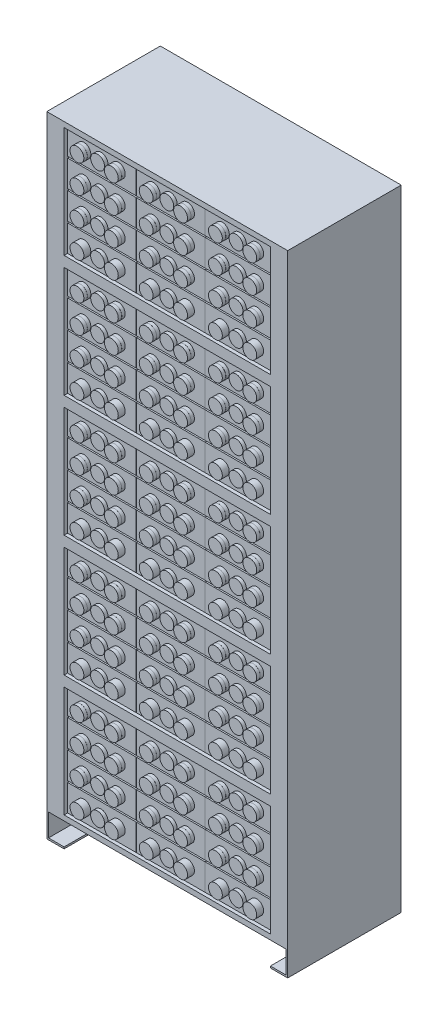
from build123d import *

# Parameters (mm, degrees)
SKETCH1_W           = 596
SKETCH1_H           = 320
BOSS_EXTRUDE1_DEPTH = 405
SKETCH2_W           = 198.4
SKETCH2_H           = 76.8
BOSS_EXTRUDE2_DEPTH = 318
SKETCH3_R           = 20
BOSS_EXTRUDE3_DEPTH = 10
CUT_EXTRUDE1_DEPTH  = 77
SKETCH5_R           = 20
BOSS_EXTRUDE5_DEPTH = 10


with BuildPart() as part:
    # Sketch1 → Boss-Extrude1 (new body)
    with BuildSketch(Plane.XY):
        Polygon((0, 0), (0, 1820), (696, 1820), (696, 0), (646, 0), (646, 5), (691, 5), (691, 70), (646, 70), (50, 70), (5, 70), (5, 5), (50, 5), (50, 0), align=None)
        with Locations((348, 595)):
            Rectangle(SKETCH1_W, SKETCH1_H, mode=Mode.SUBTRACT)
        with Locations((348, 245)):
            Rectangle(SKETCH1_W, SKETCH1_H, mode=Mode.SUBTRACT)
        with Locations((348, 945)):
            Rectangle(SKETCH1_W, SKETCH1_H, mode=Mode.SUBTRACT)
        with Locations((348, 1295)):
            Rectangle(SKETCH1_W, SKETCH1_H, mode=Mode.SUBTRACT)
        with Locations((348, 1645)):
            Rectangle(SKETCH1_W, SKETCH1_H, mode=Mode.SUBTRACT)
    extrude(amount=-BOSS_EXTRUDE1_DEPTH)

    # Sketch2 → Boss-Extrude2 (add)
    with BuildSketch(Plane(origin=(0, 0, -405), x_dir=(-1, 0, 0), z_dir=(0, 0, -1))):
        with Locations((-348, 122.966053356)):
            Rectangle(SKETCH2_W, SKETCH2_H)
        with Locations((-348, 472.966053356)):
            Rectangle(SKETCH2_W, SKETCH2_H)
        with Locations((-149.2, 472.966053356)):
            Rectangle(SKETCH2_W, SKETCH2_H)
        with Locations((-149.2, 122.966053356)):
            Rectangle(SKETCH2_W, SKETCH2_H)
        with Locations((-546.8, 122.966053356)):
            Rectangle(SKETCH2_W, SKETCH2_H)
        with Locations((-348, 204.177368904)):
            Rectangle(SKETCH2_W, SKETCH2_H)
        with Locations((-546.8, 204.177368904)):
            Rectangle(SKETCH2_W, SKETCH2_H)
        with Locations((-348, 285.388684452)):
            Rectangle(SKETCH2_W, SKETCH2_H)
        with Locations((-546.8, 285.388684452)):
            Rectangle(SKETCH2_W, SKETCH2_H)
        with Locations((-348, 366.6)):
            Rectangle(SKETCH2_W, SKETCH2_H)
        with Locations((-546.8, 366.6)):
            Rectangle(SKETCH2_W, SKETCH2_H)
        with Locations((-149.2, 204.177368904)):
            Rectangle(SKETCH2_W, SKETCH2_H)
        with Locations((-149.2, 285.388684452)):
            Rectangle(SKETCH2_W, SKETCH2_H)
        with Locations((-149.2, 366.6)):
            Rectangle(SKETCH2_W, SKETCH2_H)
        with Locations((-546.8, 472.966053356)):
            Rectangle(SKETCH2_W, SKETCH2_H)
        with Locations((-348, 554.177368904)):
            Rectangle(SKETCH2_W, SKETCH2_H)
        with Locations((-546.8, 554.177368904)):
            Rectangle(SKETCH2_W, SKETCH2_H)
        with Locations((-348, 635.388684452)):
            Rectangle(SKETCH2_W, SKETCH2_H)
        with Locations((-546.8, 635.388684452)):
            Rectangle(SKETCH2_W, SKETCH2_H)
        with Locations((-348, 716.6)):
            Rectangle(SKETCH2_W, SKETCH2_H)
        with Locations((-546.8, 716.6)):
            Rectangle(SKETCH2_W, SKETCH2_H)
        with Locations((-149.2, 554.177368904)):
            Rectangle(SKETCH2_W, SKETCH2_H)
        with Locations((-149.2, 635.388684452)):
            Rectangle(SKETCH2_W, SKETCH2_H)
        with Locations((-149.2, 716.6)):
            Rectangle(SKETCH2_W, SKETCH2_H)
        with Locations((-348, 822.966053356)):
            Rectangle(SKETCH2_W, SKETCH2_H)
        with Locations((-149.2, 822.966053356)):
            Rectangle(SKETCH2_W, SKETCH2_H)
        with Locations((-546.8, 822.966053356)):
            Rectangle(SKETCH2_W, SKETCH2_H)
        with Locations((-348, 904.177368904)):
            Rectangle(SKETCH2_W, SKETCH2_H)
        with Locations((-546.8, 904.177368904)):
            Rectangle(SKETCH2_W, SKETCH2_H)
        with Locations((-348, 985.388684452)):
            Rectangle(SKETCH2_W, SKETCH2_H)
        with Locations((-546.8, 985.388684452)):
            Rectangle(SKETCH2_W, SKETCH2_H)
        with Locations((-348, 1066.6)):
            Rectangle(SKETCH2_W, SKETCH2_H)
        with Locations((-546.8, 1066.6)):
            Rectangle(SKETCH2_W, SKETCH2_H)
        with Locations((-149.2, 904.177368904)):
            Rectangle(SKETCH2_W, SKETCH2_H)
        with Locations((-149.2, 985.388684452)):
            Rectangle(SKETCH2_W, SKETCH2_H)
        with Locations((-149.2, 1066.6)):
            Rectangle(SKETCH2_W, SKETCH2_H)
        with Locations((-348, 1172.966053356)):
            Rectangle(SKETCH2_W, SKETCH2_H)
        with Locations((-149.2, 1172.966053356)):
            Rectangle(SKETCH2_W, SKETCH2_H)
        with Locations((-546.8, 1172.966053356)):
            Rectangle(SKETCH2_W, SKETCH2_H)
        with Locations((-348, 1254.177368904)):
            Rectangle(SKETCH2_W, SKETCH2_H)
        with Locations((-546.8, 1254.177368904)):
            Rectangle(SKETCH2_W, SKETCH2_H)
        with Locations((-348, 1335.388684452)):
            Rectangle(SKETCH2_W, SKETCH2_H)
        with Locations((-546.8, 1335.388684452)):
            Rectangle(SKETCH2_W, SKETCH2_H)
        with Locations((-348, 1416.6)):
            Rectangle(SKETCH2_W, SKETCH2_H)
        with Locations((-546.8, 1416.6)):
            Rectangle(SKETCH2_W, SKETCH2_H)
        with Locations((-149.2, 1254.177368904)):
            Rectangle(SKETCH2_W, SKETCH2_H)
        with Locations((-149.2, 1335.388684452)):
            Rectangle(SKETCH2_W, SKETCH2_H)
        with Locations((-149.2, 1416.6)):
            Rectangle(SKETCH2_W, SKETCH2_H)
        with Locations((-348, 1522.966053356)):
            Rectangle(SKETCH2_W, SKETCH2_H)
        with Locations((-149.2, 1522.966053356)):
            Rectangle(SKETCH2_W, SKETCH2_H)
        with Locations((-546.8, 1522.966053356)):
            Rectangle(SKETCH2_W, SKETCH2_H)
        with Locations((-348, 1604.177368904)):
            Rectangle(SKETCH2_W, SKETCH2_H)
        with Locations((-546.8, 1604.177368904)):
            Rectangle(SKETCH2_W, SKETCH2_H)
        with Locations((-348, 1685.388684452)):
            Rectangle(SKETCH2_W, SKETCH2_H)
        with Locations((-546.8, 1685.388684452)):
            Rectangle(SKETCH2_W, SKETCH2_H)
        with Locations((-348, 1766.6)):
            Rectangle(SKETCH2_W, SKETCH2_H)
        with Locations((-546.8, 1766.6)):
            Rectangle(SKETCH2_W, SKETCH2_H)
        with Locations((-149.2, 1604.177368904)):
            Rectangle(SKETCH2_W, SKETCH2_H)
        with Locations((-149.2, 1685.388684452)):
            Rectangle(SKETCH2_W, SKETCH2_H)
        with Locations((-149.2, 1766.6)):
            Rectangle(SKETCH2_W, SKETCH2_H)
    extrude(amount=-BOSS_EXTRUDE2_DEPTH)


with BuildPart() as boss_extrude2_piece_1:
    # of the separate pieces the step leaves, piece 1, a body of its own (boss_extrude2_pieces)
    add(part.part.solids().sort_by_distance((0, 0, 0))[0])



with BuildPart() as boss_extrude2_piece_2:
    # of the separate pieces the step leaves, piece 2, a body of its own (boss_extrude2_pieces)
    add(part.part.solids().sort_by_distance((447.2, 1723.788684452, -405))[0])


with BuildPart() as boss_extrude2_piece_3:
    # of the separate pieces the step leaves, piece 3, a body of its own (boss_extrude2_pieces)
    add(part.part.solids().sort_by_distance((447.2, 592.577368904, -405))[0])


with BuildPart() as boss_extrude2_piece_4:
    # of the separate pieces the step leaves, piece 4, a body of its own (boss_extrude2_pieces)
    add(part.part.solids().sort_by_distance((447.2, 942.577368904, -405))[0])


with BuildPart() as boss_extrude2_piece_5:
    # of the separate pieces the step leaves, piece 5, a body of its own (boss_extrude2_pieces)
    add(part.part.solids().sort_by_distance((447.2, 242.577368904, -405))[0])


with BuildPart() as boss_extrude2_piece_6:
    # of the separate pieces the step leaves, piece 6, a body of its own (boss_extrude2_pieces)
    add(part.part.solids().sort_by_distance((447.2, 1642.577368904, -405))[0])


with BuildPart() as boss_extrude2_piece_7:
    # of the separate pieces the step leaves, piece 7, a body of its own (boss_extrude2_pieces)
    add(part.part.solids().sort_by_distance((447.2, 323.788684452, -405))[0])


with BuildPart() as boss_extrude2_piece_8:
    # of the separate pieces the step leaves, piece 8, a body of its own (boss_extrude2_pieces)
    add(part.part.solids().sort_by_distance((447.2, 673.788684452, -405))[0])


with BuildPart() as boss_extrude2_piece_9:
    # of the separate pieces the step leaves, piece 9, a body of its own (boss_extrude2_pieces)
    add(part.part.solids().sort_by_distance((447.2, 1023.788684452, -405))[0])


with BuildPart() as boss_extrude2_piece_10:
    # of the separate pieces the step leaves, piece 10, a body of its own (boss_extrude2_pieces)
    add(part.part.solids().sort_by_distance((447.2, 1292.577368904, -405))[0])


with BuildPart() as boss_extrude2_piece_11:
    # of the separate pieces the step leaves, piece 11, a body of its own (boss_extrude2_pieces)
    add(part.part.solids().sort_by_distance((447.2, 1373.788684452, -405))[0])


with BuildPart() as boss_extrude2_piece_1_1:
    add(boss_extrude2_piece_1.part)

    add(boss_extrude2_piece_2.part)  # Boss-Extrude3 merges Boss-Extrude2 piece 2

    add(boss_extrude2_piece_3.part)  # Boss-Extrude3 merges Boss-Extrude2 piece 3

    add(boss_extrude2_piece_4.part)  # Boss-Extrude3 merges Boss-Extrude2 piece 4

    add(boss_extrude2_piece_5.part)  # Boss-Extrude3 merges Boss-Extrude2 piece 5

    add(boss_extrude2_piece_6.part)  # Boss-Extrude3 merges Boss-Extrude2 piece 6

    add(boss_extrude2_piece_7.part)  # Boss-Extrude3 merges Boss-Extrude2 piece 7

    add(boss_extrude2_piece_8.part)  # Boss-Extrude3 merges Boss-Extrude2 piece 8

    add(boss_extrude2_piece_9.part)  # Boss-Extrude3 merges Boss-Extrude2 piece 9

    add(boss_extrude2_piece_10.part)  # Boss-Extrude3 merges Boss-Extrude2 piece 10

    add(boss_extrude2_piece_11.part)  # Boss-Extrude3 merges Boss-Extrude2 piece 11
    # Sketch3 → Boss-Extrude3 (add)
    with BuildSketch(Plane.XY.offset(-87)):
        with Locations((546.6, 123.183026678)):
            Circle(SKETCH3_R)
        with Locations((497.1, 123.183026678)):
            Circle(SKETCH3_R)
        with Locations(Location((596.5, 123.183026678, 0), (0, 0, 180))):
            Circle(SKETCH3_R)
        with Locations((297.1, 123.183026678)):
            Circle(SKETCH3_R)
        with Locations((346.6, 123.183026678)):
            Circle(SKETCH3_R)
        with Locations(Location((396.5, 123.183026678, 0), (0, 0, 180))):
            Circle(SKETCH3_R)
        with Locations((97.1, 123.183026678)):
            Circle(SKETCH3_R)
        with Locations((146.6, 123.183026678)):
            Circle(SKETCH3_R)
        with Locations(Location((196.5, 123.183026678, 0), (0, 0, 180))):
            Circle(SKETCH3_R)
        with Locations((297.166666667, 204.322017785)):
            Circle(SKETCH3_R)
        with Locations((346.666666667, 204.322017785)):
            Circle(SKETCH3_R)
        with Locations(Location((396.566666667, 204.322017785, 0), (0, 0, 180))):
            Circle(SKETCH3_R)
        with Locations((97.166666667, 204.322017785)):
            Circle(SKETCH3_R)
        with Locations((146.666666667, 204.322017785)):
            Circle(SKETCH3_R)
        with Locations(Location((196.566666667, 204.322017785, 0), (0, 0, 180))):
            Circle(SKETCH3_R)
        with Locations((297.233333333, 285.461008893)):
            Circle(SKETCH3_R)
        with Locations((346.733333333, 285.461008893)):
            Circle(SKETCH3_R)
        with Locations(Location((396.633333333, 285.461008893, 0), (0, 0, 180))):
            Circle(SKETCH3_R)
        with Locations((97.233333333, 285.461008893)):
            Circle(SKETCH3_R)
        with Locations((146.733333333, 285.461008893)):
            Circle(SKETCH3_R)
        with Locations(Location((196.633333333, 285.461008893, 0), (0, 0, 180))):
            Circle(SKETCH3_R)
        with Locations((297.3, 366.6)):
            Circle(SKETCH3_R)
        with Locations((346.8, 366.6)):
            Circle(SKETCH3_R)
        with Locations(Location((396.7, 366.6, 0), (0, 0, 180))):
            Circle(SKETCH3_R)
        with Locations((97.3, 366.6)):
            Circle(SKETCH3_R)
        with Locations((146.8, 366.6)):
            Circle(SKETCH3_R)
        with Locations(Location((196.7, 366.6, 0), (0, 0, 180))):
            Circle(SKETCH3_R)
        with Locations((497.166666667, 204.322017785)):
            Circle(SKETCH3_R)
        with Locations((546.666666667, 204.322017785)):
            Circle(SKETCH3_R)
        with Locations(Location((596.566666667, 204.322017785, 0), (0, 0, 180))):
            Circle(SKETCH3_R)
        with Locations((497.233333333, 285.461008893)):
            Circle(SKETCH3_R)
        with Locations((546.733333333, 285.461008893)):
            Circle(SKETCH3_R)
        with Locations(Location((596.633333333, 285.461008893, 0), (0, 0, 180))):
            Circle(SKETCH3_R)
        with Locations((497.3, 366.6)):
            Circle(SKETCH3_R)
        with Locations((546.8, 366.6)):
            Circle(SKETCH3_R)
        with Locations(Location((596.7, 366.6, 0), (0, 0, 180))):
            Circle(SKETCH3_R)
        with Locations((546.6, 473.183026678)):
            Circle(SKETCH3_R)
        with Locations((497.1, 473.183026678)):
            Circle(SKETCH3_R)
        with Locations(Location((596.5, 473.183026678, 0), (0, 0, 180))):
            Circle(SKETCH3_R)
        with Locations((297.1, 473.183026678)):
            Circle(SKETCH3_R)
        with Locations((346.6, 473.183026678)):
            Circle(SKETCH3_R)
        with Locations(Location((396.5, 473.183026678, 0), (0, 0, 180))):
            Circle(SKETCH3_R)
        with Locations((97.1, 473.183026678)):
            Circle(SKETCH3_R)
        with Locations((146.6, 473.183026678)):
            Circle(SKETCH3_R)
        with Locations(Location((196.5, 473.183026678, 0), (0, 0, 180))):
            Circle(SKETCH3_R)
        with Locations((297.166666667, 554.322017785)):
            Circle(SKETCH3_R)
        with Locations((346.666666667, 554.322017785)):
            Circle(SKETCH3_R)
        with Locations(Location((396.566666667, 554.322017785, 0), (0, 0, 180))):
            Circle(SKETCH3_R)
        with Locations((97.166666667, 554.322017785)):
            Circle(SKETCH3_R)
        with Locations((146.666666667, 554.322017785)):
            Circle(SKETCH3_R)
        with Locations(Location((196.566666667, 554.322017785, 0), (0, 0, 180))):
            Circle(SKETCH3_R)
        with Locations((297.233333333, 635.461008893)):
            Circle(SKETCH3_R)
        with Locations((346.733333333, 635.461008893)):
            Circle(SKETCH3_R)
        with Locations(Location((396.633333333, 635.461008893, 0), (0, 0, 180))):
            Circle(SKETCH3_R)
        with Locations((97.233333333, 635.461008893)):
            Circle(SKETCH3_R)
        with Locations((146.733333333, 635.461008893)):
            Circle(SKETCH3_R)
        with Locations(Location((196.633333333, 635.461008893, 0), (0, 0, 180))):
            Circle(SKETCH3_R)
        with Locations((297.3, 716.6)):
            Circle(SKETCH3_R)
        with Locations((346.8, 716.6)):
            Circle(SKETCH3_R)
        with Locations(Location((396.7, 716.6, 0), (0, 0, 180))):
            Circle(SKETCH3_R)
        with Locations((97.3, 716.6)):
            Circle(SKETCH3_R)
        with Locations((146.8, 716.6)):
            Circle(SKETCH3_R)
        with Locations(Location((196.7, 716.6, 0), (0, 0, 180))):
            Circle(SKETCH3_R)
        with Locations((497.166666667, 554.322017785)):
            Circle(SKETCH3_R)
        with Locations((546.666666667, 554.322017785)):
            Circle(SKETCH3_R)
        with Locations(Location((596.566666667, 554.322017785, 0), (0, 0, 180))):
            Circle(SKETCH3_R)
        with Locations((497.233333333, 635.461008893)):
            Circle(SKETCH3_R)
        with Locations((546.733333333, 635.461008893)):
            Circle(SKETCH3_R)
        with Locations(Location((596.633333333, 635.461008893, 0), (0, 0, 180))):
            Circle(SKETCH3_R)
        with Locations((497.3, 716.6)):
            Circle(SKETCH3_R)
        with Locations((546.8, 716.6)):
            Circle(SKETCH3_R)
        with Locations(Location((596.7, 716.6, 0), (0, 0, 180))):
            Circle(SKETCH3_R)
        with Locations((546.6, 823.183026678)):
            Circle(SKETCH3_R)
        with Locations((497.1, 823.183026678)):
            Circle(SKETCH3_R)
        with Locations(Location((596.5, 823.183026678, 0), (0, 0, 180))):
            Circle(SKETCH3_R)
        with Locations((297.1, 823.183026678)):
            Circle(SKETCH3_R)
        with Locations((346.6, 823.183026678)):
            Circle(SKETCH3_R)
        with Locations(Location((396.5, 823.183026678, 0), (0, 0, 180))):
            Circle(SKETCH3_R)
        with Locations((97.1, 823.183026678)):
            Circle(SKETCH3_R)
        with Locations((146.6, 823.183026678)):
            Circle(SKETCH3_R)
        with Locations(Location((196.5, 823.183026678, 0), (0, 0, 180))):
            Circle(SKETCH3_R)
        with Locations((297.166666667, 904.322017785)):
            Circle(SKETCH3_R)
        with Locations((346.666666667, 904.322017785)):
            Circle(SKETCH3_R)
        with Locations(Location((396.566666667, 904.322017785, 0), (0, 0, 180))):
            Circle(SKETCH3_R)
        with Locations((97.166666667, 904.322017785)):
            Circle(SKETCH3_R)
        with Locations((146.666666667, 904.322017785)):
            Circle(SKETCH3_R)
        with Locations(Location((196.566666667, 904.322017785, 0), (0, 0, 180))):
            Circle(SKETCH3_R)
        with Locations((297.233333333, 985.461008893)):
            Circle(SKETCH3_R)
        with Locations((346.733333333, 985.461008893)):
            Circle(SKETCH3_R)
        with Locations(Location((396.633333333, 985.461008893, 0), (0, 0, 180))):
            Circle(SKETCH3_R)
        with Locations((97.233333333, 985.461008893)):
            Circle(SKETCH3_R)
        with Locations((146.733333333, 985.461008893)):
            Circle(SKETCH3_R)
        with Locations(Location((196.633333333, 985.461008893, 0), (0, 0, 180))):
            Circle(SKETCH3_R)
        with Locations((297.3, 1066.6)):
            Circle(SKETCH3_R)
        with Locations((346.8, 1066.6)):
            Circle(SKETCH3_R)
        with Locations(Location((396.7, 1066.6, 0), (0, 0, 180))):
            Circle(SKETCH3_R)
        with Locations((97.3, 1066.6)):
            Circle(SKETCH3_R)
        with Locations((146.8, 1066.6)):
            Circle(SKETCH3_R)
        with Locations(Location((196.7, 1066.6, 0), (0, 0, 180))):
            Circle(SKETCH3_R)
        with Locations((497.166666667, 904.322017785)):
            Circle(SKETCH3_R)
        with Locations((546.666666667, 904.322017785)):
            Circle(SKETCH3_R)
        with Locations(Location((596.566666667, 904.322017785, 0), (0, 0, 180))):
            Circle(SKETCH3_R)
        with Locations((497.233333333, 985.461008893)):
            Circle(SKETCH3_R)
        with Locations((546.733333333, 985.461008893)):
            Circle(SKETCH3_R)
        with Locations(Location((596.633333333, 985.461008893, 0), (0, 0, 180))):
            Circle(SKETCH3_R)
        with Locations((497.3, 1066.6)):
            Circle(SKETCH3_R)
        with Locations((546.8, 1066.6)):
            Circle(SKETCH3_R)
        with Locations(Location((596.7, 1066.6, 0), (0, 0, 180))):
            Circle(SKETCH3_R)
        with Locations((546.6, 1173.183026678)):
            Circle(SKETCH3_R)
        with Locations((497.1, 1173.183026678)):
            Circle(SKETCH3_R)
        with Locations(Location((596.5, 1173.183026678, 0), (0, 0, 180))):
            Circle(SKETCH3_R)
        with Locations((297.1, 1173.183026678)):
            Circle(SKETCH3_R)
        with Locations((346.6, 1173.183026678)):
            Circle(SKETCH3_R)
        with Locations(Location((396.5, 1173.183026678, 0), (0, 0, 180))):
            Circle(SKETCH3_R)
        with Locations((97.1, 1173.183026678)):
            Circle(SKETCH3_R)
        with Locations((146.6, 1173.183026678)):
            Circle(SKETCH3_R)
        with Locations(Location((196.5, 1173.183026678, 0), (0, 0, 180))):
            Circle(SKETCH3_R)
        with Locations((297.166666667, 1254.322017785)):
            Circle(SKETCH3_R)
        with Locations((346.666666667, 1254.322017785)):
            Circle(SKETCH3_R)
        with Locations(Location((396.566666667, 1254.322017785, 0), (0, 0, 180))):
            Circle(SKETCH3_R)
        with Locations((97.166666667, 1254.322017785)):
            Circle(SKETCH3_R)
        with Locations((146.666666667, 1254.322017785)):
            Circle(SKETCH3_R)
        with Locations(Location((196.566666667, 1254.322017785, 0), (0, 0, 180))):
            Circle(SKETCH3_R)
        with Locations((297.233333333, 1335.461008893)):
            Circle(SKETCH3_R)
        with Locations((346.733333333, 1335.461008893)):
            Circle(SKETCH3_R)
        with Locations(Location((396.633333333, 1335.461008893, 0), (0, 0, 180))):
            Circle(SKETCH3_R)
        with Locations((97.233333333, 1335.461008893)):
            Circle(SKETCH3_R)
        with Locations((146.733333333, 1335.461008893)):
            Circle(SKETCH3_R)
        with Locations(Location((196.633333333, 1335.461008893, 0), (0, 0, 180))):
            Circle(SKETCH3_R)
        with Locations((297.3, 1416.6)):
            Circle(SKETCH3_R)
        with Locations((346.8, 1416.6)):
            Circle(SKETCH3_R)
        with Locations(Location((396.7, 1416.6, 0), (0, 0, 180))):
            Circle(SKETCH3_R)
        with Locations((97.3, 1416.6)):
            Circle(SKETCH3_R)
        with Locations((146.8, 1416.6)):
            Circle(SKETCH3_R)
        with Locations(Location((196.7, 1416.6, 0), (0, 0, 180))):
            Circle(SKETCH3_R)
        with Locations((497.166666667, 1254.322017785)):
            Circle(SKETCH3_R)
        with Locations((546.666666667, 1254.322017785)):
            Circle(SKETCH3_R)
        with Locations(Location((596.566666667, 1254.322017785, 0), (0, 0, 180))):
            Circle(SKETCH3_R)
        with Locations((497.233333333, 1335.461008893)):
            Circle(SKETCH3_R)
        with Locations((546.733333333, 1335.461008893)):
            Circle(SKETCH3_R)
        with Locations(Location((596.633333333, 1335.461008893, 0), (0, 0, 180))):
            Circle(SKETCH3_R)
        with Locations((497.3, 1416.6)):
            Circle(SKETCH3_R)
        with Locations((546.8, 1416.6)):
            Circle(SKETCH3_R)
        with Locations(Location((596.7, 1416.6, 0), (0, 0, 180))):
            Circle(SKETCH3_R)
        with Locations((546.6, 1523.183026678)):
            Circle(SKETCH3_R)
        with Locations((497.1, 1523.183026678)):
            Circle(SKETCH3_R)
        with Locations(Location((596.5, 1523.183026678, 0), (0, 0, 180))):
            Circle(SKETCH3_R)
        with Locations((297.1, 1523.183026678)):
            Circle(SKETCH3_R)
        with Locations((346.6, 1523.183026678)):
            Circle(SKETCH3_R)
        with Locations(Location((396.5, 1523.183026678, 0), (0, 0, 180))):
            Circle(SKETCH3_R)
        with Locations((97.1, 1523.183026678)):
            Circle(SKETCH3_R)
        with Locations((146.6, 1523.183026678)):
            Circle(SKETCH3_R)
        with Locations(Location((196.5, 1523.183026678, 0), (0, 0, 180))):
            Circle(SKETCH3_R)
        with Locations((297.166666667, 1604.322017785)):
            Circle(SKETCH3_R)
        with Locations((346.666666667, 1604.322017785)):
            Circle(SKETCH3_R)
        with Locations(Location((396.566666667, 1604.322017785, 0), (0, 0, 180))):
            Circle(SKETCH3_R)
        with Locations((97.166666667, 1604.322017785)):
            Circle(SKETCH3_R)
        with Locations((146.666666667, 1604.322017785)):
            Circle(SKETCH3_R)
        with Locations(Location((196.566666667, 1604.322017785, 0), (0, 0, 180))):
            Circle(SKETCH3_R)
        with Locations((297.233333333, 1685.461008893)):
            Circle(SKETCH3_R)
        with Locations((346.733333333, 1685.461008893)):
            Circle(SKETCH3_R)
        with Locations(Location((396.633333333, 1685.461008893, 0), (0, 0, 180))):
            Circle(SKETCH3_R)
        with Locations((97.233333333, 1685.461008893)):
            Circle(SKETCH3_R)
        with Locations((146.733333333, 1685.461008893)):
            Circle(SKETCH3_R)
        with Locations(Location((196.633333333, 1685.461008893, 0), (0, 0, 180))):
            Circle(SKETCH3_R)
        with Locations((297.3, 1766.6)):
            Circle(SKETCH3_R)
        with Locations((346.8, 1766.6)):
            Circle(SKETCH3_R)
        with Locations(Location((396.7, 1766.6, 0), (0, 0, 180))):
            Circle(SKETCH3_R)
        with Locations((97.3, 1766.6)):
            Circle(SKETCH3_R)
        with Locations((146.8, 1766.6)):
            Circle(SKETCH3_R)
        with Locations(Location((196.7, 1766.6, 0), (0, 0, 180))):
            Circle(SKETCH3_R)
        with Locations((497.166666667, 1604.322017785)):
            Circle(SKETCH3_R)
        with Locations((546.666666667, 1604.322017785)):
            Circle(SKETCH3_R)
        with Locations(Location((596.566666667, 1604.322017785, 0), (0, 0, 180))):
            Circle(SKETCH3_R)
        with Locations((497.233333333, 1685.461008893)):
            Circle(SKETCH3_R)
        with Locations((546.733333333, 1685.461008893)):
            Circle(SKETCH3_R)
        with Locations(Location((596.633333333, 1685.461008893, 0), (0, 0, 180))):
            Circle(SKETCH3_R)
        with Locations((497.3, 1766.6)):
            Circle(SKETCH3_R)
        with Locations((546.8, 1766.6)):
            Circle(SKETCH3_R)
        with Locations(Location((596.7, 1766.6, 0), (0, 0, 180))):
            Circle(SKETCH3_R)
    extrude(amount=BOSS_EXTRUDE3_DEPTH)

    # Sketch4 → Cut-Extrude1 (cut)
    with BuildSketch(Plane.XY):
        Polygon((0, 0), (50, 0), (50, 5), (5, 5), (5, 70), (691, 70), (691, 5), (646, 5), (646, 0), (696, 0), (696, 1820), (0, 1820), align=None)
    extrude(amount=-CUT_EXTRUDE1_DEPTH, mode=Mode.SUBTRACT)

    # Sketch5 → Boss-Extrude5 (add)
    with BuildSketch(Plane.XY.offset(-77)):
        with Locations(Location((596.5, 123.183026678, 0), (0, 0, 180))):
            Circle(SKETCH5_R)
        with Locations((497.1, 123.183026678)):
            Circle(SKETCH5_R)
        with Locations((297.1, 123.183026678)):
            Circle(SKETCH5_R)
        with Locations(Location((196.5, 123.183026678, 0), (0, 0, 180))):
            Circle(SKETCH5_R)
        with Locations((97.1, 123.183026678)):
            Circle(SKETCH5_R)
        with Locations(Location((396.5, 123.183026678, 0), (0, 0, 180))):
            Circle(SKETCH5_R)
        with Locations(Location((97.1, 204.322017785, 0), (0, 0, 270.09549301))):
            Circle(SKETCH5_R)
        with Locations(Location((196.5, 204.322017785, 0), (0, 0, 270.09549301))):
            Circle(SKETCH5_R)
        with Locations(Location((297.1, 204.322017785, 0), (0, 0, 270.09549301))):
            Circle(SKETCH5_R)
        with Locations(Location((396.5, 204.322017785, 0), (0, 0, 270.09549301))):
            Circle(SKETCH5_R)
        with Locations(Location((497.1, 204.322017785, 0), (0, 0, 270.095493008))):
            Circle(SKETCH5_R)
        with Locations(Location((596.5, 204.322017785, 0), (0, 0, 270.09549301))):
            Circle(SKETCH5_R)
        with Locations(Location((97.1, 285.461008893, 0), (0, 0, 270.190986285))):
            Circle(SKETCH5_R)
        with Locations(Location((196.5, 285.461008893, 0), (0, 0, 270.190986285))):
            Circle(SKETCH5_R)
        with Locations(Location((297.1, 285.461008893, 0), (0, 0, 270.190986285))):
            Circle(SKETCH5_R)
        with Locations(Location((396.5, 285.461008893, 0), (0, 0, 270.190986285))):
            Circle(SKETCH5_R)
        with Locations(Location((497.1, 285.461008893, 0), (0, 0, 270.190986284))):
            Circle(SKETCH5_R)
        with Locations(Location((596.5, 285.461008893, 0), (0, 0, 270.190986285))):
            Circle(SKETCH5_R)
        with Locations(Location((97.1, 366.6, 0), (0, 0, 89.713519909))):
            Circle(SKETCH5_R)
        with Locations(Location((196.5, 366.6, 0), (0, 0, 270.286480091))):
            Circle(SKETCH5_R)
        with Locations(Location((297.1, 366.6, 0), (0, 0, 270.286480091))):
            Circle(SKETCH5_R)
        with Locations(Location((396.5, 366.6, 0), (0, 0, 270.286480091))):
            Circle(SKETCH5_R)
        with Locations(Location((497.1, 366.6, 0), (0, 0, 270.28648009))):
            Circle(SKETCH5_R)
        with Locations(Location((596.5, 366.6, 0), (0, 0, 270.286480091))):
            Circle(SKETCH5_R)
        with Locations(Location((596.5, 473.183026678, 0), (0, 0, 180))):
            Circle(SKETCH5_R)
        with Locations((497.1, 473.183026678)):
            Circle(SKETCH5_R)
        with Locations((297.1, 473.183026678)):
            Circle(SKETCH5_R)
        with Locations(Location((196.5, 473.183026678, 0), (0, 0, 180))):
            Circle(SKETCH5_R)
        with Locations((97.1, 473.183026678)):
            Circle(SKETCH5_R)
        with Locations(Location((396.5, 473.183026678, 0), (0, 0, 180))):
            Circle(SKETCH5_R)
        with Locations(Location((97.1, 554.322017785, 0), (0, 0, 270.09549301))):
            Circle(SKETCH5_R)
        with Locations(Location((196.5, 554.322017785, 0), (0, 0, 270.09549301))):
            Circle(SKETCH5_R)
        with Locations(Location((297.1, 554.322017785, 0), (0, 0, 270.09549301))):
            Circle(SKETCH5_R)
        with Locations(Location((396.5, 554.322017785, 0), (0, 0, 270.09549301))):
            Circle(SKETCH5_R)
        with Locations(Location((497.1, 554.322017785, 0), (0, 0, 270.095493008))):
            Circle(SKETCH5_R)
        with Locations(Location((596.5, 554.322017785, 0), (0, 0, 270.09549301))):
            Circle(SKETCH5_R)
        with Locations(Location((97.1, 635.461008893, 0), (0, 0, 270.190986285))):
            Circle(SKETCH5_R)
        with Locations(Location((196.5, 635.461008893, 0), (0, 0, 270.190986285))):
            Circle(SKETCH5_R)
        with Locations(Location((297.1, 635.461008893, 0), (0, 0, 270.190986285))):
            Circle(SKETCH5_R)
        with Locations(Location((396.5, 635.461008893, 0), (0, 0, 270.190986285))):
            Circle(SKETCH5_R)
        with Locations(Location((497.1, 635.461008893, 0), (0, 0, 270.190986284))):
            Circle(SKETCH5_R)
        with Locations(Location((596.5, 635.461008893, 0), (0, 0, 270.190986285))):
            Circle(SKETCH5_R)
        with Locations(Location((97.1, 716.6, 0), (0, 0, 270.286480091))):
            Circle(SKETCH5_R)
        with Locations(Location((196.5, 716.6, 0), (0, 0, 270.286480091))):
            Circle(SKETCH5_R)
        with Locations(Location((297.1, 716.6, 0), (0, 0, 270.286480091))):
            Circle(SKETCH5_R)
        with Locations(Location((396.5, 716.6, 0), (0, 0, 270.286480091))):
            Circle(SKETCH5_R)
        with Locations(Location((497.1, 716.6, 0), (0, 0, 270.28648009))):
            Circle(SKETCH5_R)
        with Locations(Location((596.5, 716.6, 0), (0, 0, 270.286480091))):
            Circle(SKETCH5_R)
        with Locations(Location((596.5, 823.183026678, 0), (0, 0, 180))):
            Circle(SKETCH5_R)
        with Locations((497.1, 823.183026678)):
            Circle(SKETCH5_R)
        with Locations((297.1, 823.183026678)):
            Circle(SKETCH5_R)
        with Locations(Location((196.5, 823.183026678, 0), (0, 0, 180))):
            Circle(SKETCH5_R)
        with Locations((97.1, 823.183026678)):
            Circle(SKETCH5_R)
        with Locations(Location((396.5, 823.183026678, 0), (0, 0, 180))):
            Circle(SKETCH5_R)
        with Locations(Location((97.1, 904.322017785, 0), (0, 0, 270.09549301))):
            Circle(SKETCH5_R)
        with Locations(Location((196.5, 904.322017785, 0), (0, 0, 270.09549301))):
            Circle(SKETCH5_R)
        with Locations(Location((297.1, 904.322017785, 0), (0, 0, 270.09549301))):
            Circle(SKETCH5_R)
        with Locations(Location((396.5, 904.322017785, 0), (0, 0, 270.09549301))):
            Circle(SKETCH5_R)
        with Locations(Location((497.1, 904.322017785, 0), (0, 0, 270.095493008))):
            Circle(SKETCH5_R)
        with Locations(Location((596.5, 904.322017785, 0), (0, 0, 270.09549301))):
            Circle(SKETCH5_R)
        with Locations(Location((97.1, 985.461008893, 0), (0, 0, 270.190986285))):
            Circle(SKETCH5_R)
        with Locations(Location((196.5, 985.461008893, 0), (0, 0, 270.190986285))):
            Circle(SKETCH5_R)
        with Locations(Location((297.1, 985.461008893, 0), (0, 0, 270.190986285))):
            Circle(SKETCH5_R)
        with Locations(Location((396.5, 985.461008893, 0), (0, 0, 270.190986285))):
            Circle(SKETCH5_R)
        with Locations(Location((497.1, 985.461008893, 0), (0, 0, 270.190986284))):
            Circle(SKETCH5_R)
        with Locations(Location((596.5, 985.461008893, 0), (0, 0, 270.190986285))):
            Circle(SKETCH5_R)
        with Locations(Location((97.1, 1066.6, 0), (0, 0, 89.713519909))):
            Circle(SKETCH5_R)
        with Locations(Location((196.5, 1066.6, 0), (0, 0, 270.286480091))):
            Circle(SKETCH5_R)
        with Locations(Location((297.1, 1066.6, 0), (0, 0, 270.286480091))):
            Circle(SKETCH5_R)
        with Locations(Location((396.5, 1066.6, 0), (0, 0, 270.286480091))):
            Circle(SKETCH5_R)
        with Locations(Location((497.1, 1066.6, 0), (0, 0, 270.286480091))):
            Circle(SKETCH5_R)
        with Locations(Location((596.5, 1066.6, 0), (0, 0, 270.286480091))):
            Circle(SKETCH5_R)
        with Locations(Location((596.5, 1173.183026678, 0), (0, 0, 180))):
            Circle(SKETCH5_R)
        with Locations((497.1, 1173.183026678)):
            Circle(SKETCH5_R)
        with Locations((297.1, 1173.183026678)):
            Circle(SKETCH5_R)
        with Locations(Location((196.5, 1173.183026678, 0), (0, 0, 180))):
            Circle(SKETCH5_R)
        with Locations((97.1, 1173.183026678)):
            Circle(SKETCH5_R)
        with Locations(Location((396.5, 1173.183026678, 0), (0, 0, 180))):
            Circle(SKETCH5_R)
        with Locations(Location((97.1, 1254.322017785, 0), (0, 0, 270.09549301))):
            Circle(SKETCH5_R)
        with Locations(Location((196.5, 1254.322017785, 0), (0, 0, 270.09549301))):
            Circle(SKETCH5_R)
        with Locations(Location((297.1, 1254.322017785, 0), (0, 0, 270.09549301))):
            Circle(SKETCH5_R)
        with Locations(Location((396.5, 1254.322017785, 0), (0, 0, 270.09549301))):
            Circle(SKETCH5_R)
        with Locations(Location((497.1, 1254.322017785, 0), (0, 0, 270.095493008))):
            Circle(SKETCH5_R)
        with Locations(Location((596.5, 1254.322017785, 0), (0, 0, 270.09549301))):
            Circle(SKETCH5_R)
        with Locations(Location((97.1, 1335.461008893, 0), (0, 0, 270.190986285))):
            Circle(SKETCH5_R)
        with Locations(Location((196.5, 1335.461008893, 0), (0, 0, 270.190986285))):
            Circle(SKETCH5_R)
        with Locations(Location((297.1, 1335.461008893, 0), (0, 0, 270.190986285))):
            Circle(SKETCH5_R)
        with Locations(Location((396.5, 1335.461008893, 0), (0, 0, 270.190986285))):
            Circle(SKETCH5_R)
        with Locations(Location((497.1, 1335.461008893, 0), (0, 0, 270.190986284))):
            Circle(SKETCH5_R)
        with Locations(Location((596.5, 1335.461008893, 0), (0, 0, 270.190986285))):
            Circle(SKETCH5_R)
        with Locations(Location((97.1, 1416.6, 0), (0, 0, 270.286480091))):
            Circle(SKETCH5_R)
        with Locations(Location((196.5, 1416.6, 0), (0, 0, 270.286480091))):
            Circle(SKETCH5_R)
        with Locations(Location((297.1, 1416.6, 0), (0, 0, 270.286480091))):
            Circle(SKETCH5_R)
        with Locations(Location((396.5, 1416.6, 0), (0, 0, 270.286480091))):
            Circle(SKETCH5_R)
        with Locations(Location((497.1, 1416.6, 0), (0, 0, 270.28648009))):
            Circle(SKETCH5_R)
        with Locations(Location((596.5, 1416.6, 0), (0, 0, 270.286480091))):
            Circle(SKETCH5_R)
        with Locations(Location((596.5, 1523.183026678, 0), (0, 0, 180))):
            Circle(SKETCH5_R)
        with Locations((497.1, 1523.183026678)):
            Circle(SKETCH5_R)
        with Locations((297.1, 1523.183026678)):
            Circle(SKETCH5_R)
        with Locations(Location((196.5, 1523.183026678, 0), (0, 0, 180))):
            Circle(SKETCH5_R)
        with Locations((97.1, 1523.183026678)):
            Circle(SKETCH5_R)
        with Locations(Location((396.5, 1523.183026678, 0), (0, 0, 180))):
            Circle(SKETCH5_R)
        with Locations(Location((97.1, 1604.322017785, 0), (0, 0, 270.09549301))):
            Circle(SKETCH5_R)
        with Locations(Location((196.5, 1604.322017785, 0), (0, 0, 270.09549301))):
            Circle(SKETCH5_R)
        with Locations(Location((297.1, 1604.322017785, 0), (0, 0, 270.09549301))):
            Circle(SKETCH5_R)
        with Locations(Location((396.5, 1604.322017785, 0), (0, 0, 270.09549301))):
            Circle(SKETCH5_R)
        with Locations(Location((497.1, 1604.322017785, 0), (0, 0, 270.095493008))):
            Circle(SKETCH5_R)
        with Locations(Location((596.5, 1604.322017785, 0), (0, 0, 270.09549301))):
            Circle(SKETCH5_R)
        with Locations(Location((97.1, 1685.461008893, 0), (0, 0, 270.190986285))):
            Circle(SKETCH5_R)
        with Locations(Location((196.5, 1685.461008893, 0), (0, 0, 270.190986285))):
            Circle(SKETCH5_R)
        with Locations(Location((297.1, 1685.461008893, 0), (0, 0, 270.190986285))):
            Circle(SKETCH5_R)
        with Locations(Location((396.5, 1685.461008893, 0), (0, 0, 270.190986285))):
            Circle(SKETCH5_R)
        with Locations(Location((497.1, 1685.461008893, 0), (0, 0, 270.190986284))):
            Circle(SKETCH5_R)
        with Locations(Location((596.5, 1685.461008893, 0), (0, 0, 270.190986285))):
            Circle(SKETCH5_R)
        with Locations(Location((97.1, 1766.6, 0), (0, 0, 89.713519909))):
            Circle(SKETCH5_R)
        with Locations(Location((196.5, 1766.6, 0), (0, 0, 270.286480091))):
            Circle(SKETCH5_R)
        with Locations(Location((297.1, 1766.6, 0), (0, 0, 270.286480091))):
            Circle(SKETCH5_R)
        with Locations(Location((396.5, 1766.6, 0), (0, 0, 270.286480091))):
            Circle(SKETCH5_R)
        with Locations(Location((497.1, 1766.6, 0), (0, 0, 270.28648009))):
            Circle(SKETCH5_R)
        with Locations(Location((596.5, 1766.6, 0), (0, 0, 270.286480091))):
            Circle(SKETCH5_R)
    extrude(amount=BOSS_EXTRUDE5_DEPTH)


solid = boss_extrude2_piece_1_1.part
